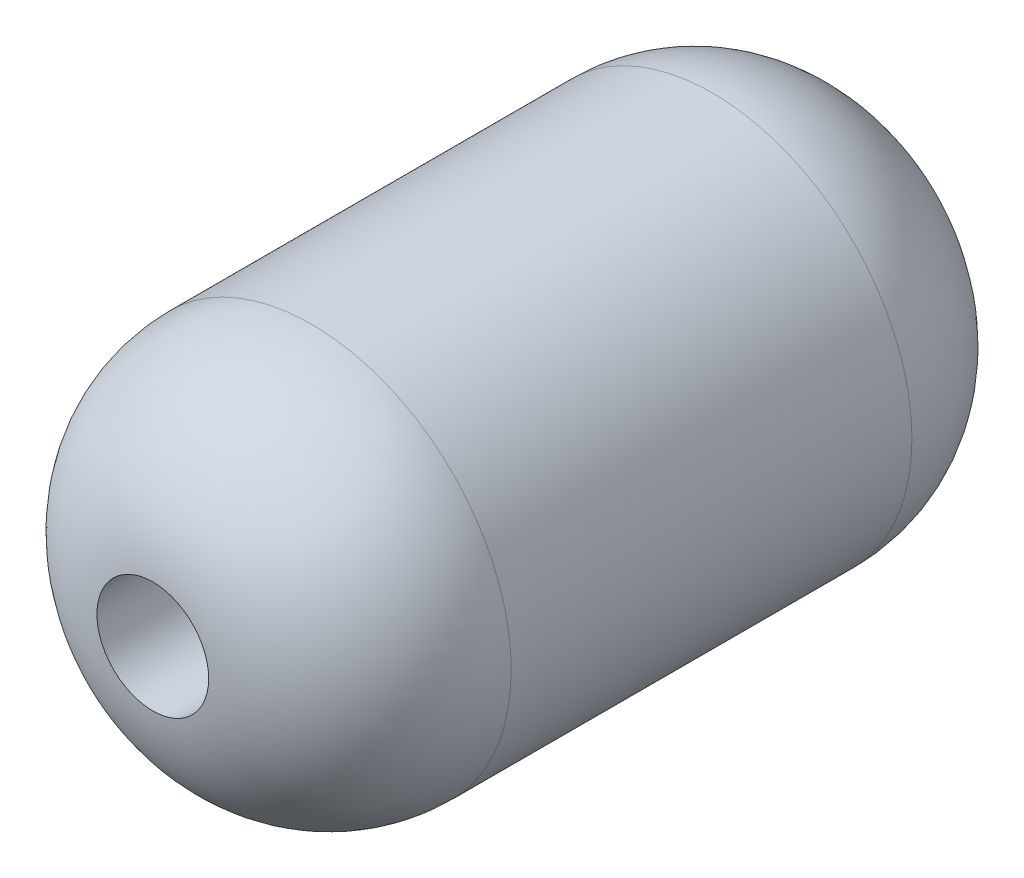
from build123d import *

# Parameters (mm, degrees)
SKETCH1_R           = 2.5
SKETCH1_R_2         = 0.7
BOSS_EXTRUDE2_DEPTH = 9
FILLET2_R           = 2


with BuildPart() as part:
    # Sketch1 → Boss-Extrude2 (new body)
    with BuildSketch(Plane.XY):
        with Locations((-4.402809494, 1.436326376)):
            Circle(SKETCH1_R)
        with Locations((-4.402809494, 1.436326376)):
            Circle(SKETCH1_R_2, mode=Mode.SUBTRACT)
    extrude(amount=BOSS_EXTRUDE2_DEPTH)

    # Fillet2
    # the kernel refuses this fillet: 2 mm, written as the material it takes off along each edge
    with BuildSketch(Plane(origin=(-4.402809494, 1.436326376, 0), x_dir=(1, 0, 0), z_dir=(0, -1, 0))) as fillet2_piece_1:
        with BuildLine():
            CenterArc((0.5, 1.989974874), FILLET2_R, 275.739170477, 84.260829523)
            Line((0.7, 0), (0.704, -0.039799497))
            ThreePointArc((0.704, -0.039799497), (1.6, -0.04), (2.5, -0.04))
            Line((2.5, -0.04), (2.54, 0))
            Line((2.54, 0), (2.54, 1.989974874))
            Line((2.54, 1.989974874), (2.5, 1.989974874))
        make_face()
    revolve(axis=Axis((-4.402809494, 1.436326376, 0), (0, 0, 1)), mode=Mode.SUBTRACT)
    with BuildSketch(Plane(origin=(-4.402809494, 1.436326376, 9), x_dir=(1, 0, 0), z_dir=(0, -1, 0))) as fillet2_piece_2:
        with BuildLine():
            CenterArc((0.5, -1.989974874), FILLET2_R, 0, 84.260829523)
            Line((0.7, 0), (0.704, 0.039799497))
            ThreePointArc((0.704, 0.039799497), (1.6, 0.04), (2.5, 0.04))
            Line((2.5, 0.04), (2.54, 0))
            Line((2.54, 0), (2.54, -1.989974874))
            Line((2.54, -1.989974874), (2.5, -1.989974874))
        make_face()
    revolve(axis=Axis((-4.402809494, 1.436326376, 9), (0, 0, 1)), mode=Mode.SUBTRACT)


solid = part.part
